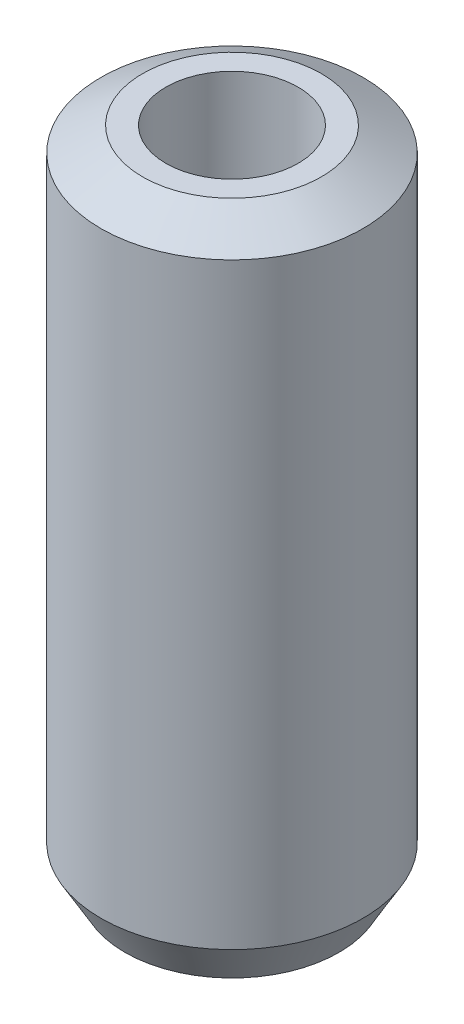
from build123d import *
from OCP.BRepFilletAPI import BRepFilletAPI_MakeChamfer

# Parameters (mm, degrees)
SKETCH1_R           = 30
BOSS_EXTRUDE1_DEPTH = 151.770530502
SKETCH2_R           = 15.139568422
CUT_EXTRUDE1_DEPTH  = 158.589003197
CHAMFER1_SIZE       = 5.49618952
CHAMFER1_SIZE2      = 9.519679497


with BuildPart() as part:
    # Sketch1 → Boss-Extrude1 (new body)
    with BuildSketch(Plane(origin=(0, 0, 0), x_dir=(1, 0, 0), z_dir=(0, 1, 0))):
        Circle(SKETCH1_R)
    extrude(amount=BOSS_EXTRUDE1_DEPTH)

    # Sketch2 → Cut-Extrude1 (cut, through all)
    with BuildSketch(Plane(origin=(0, 0, 0), x_dir=(1, 0, 0), z_dir=(0, 1, 0))):
        Circle(SKETCH2_R)
    extrude(amount=CUT_EXTRUDE1_DEPTH, mode=Mode.SUBTRACT)

    # Chamfer1: one chamfer whose edges measure the first distance from different faces: ONE call of the kernel's chamfer builder (chamfer() names one face for all edges)
    chamfer1_edges_1 = [part.edges().sort_by_distance(p)[0] for p in [
        (-30, 151.770530502, 0),
    ]]
    chamfer1_side_1 = [part.faces().sort_by_distance(p)[0] for p in [
        (-30, 75.885265251, 0),
    ]]
    chamfer1_edges_2 = [part.edges().sort_by_distance(p)[0] for p in [
        (-30, 0, 0),
    ]]
    chamfer1_side_2 = [part.faces().sort_by_distance(p)[0] for p in [
        (-29.151471863, 0, 0),
    ]]
    chamfer1 = BRepFilletAPI_MakeChamfer(part.part.solid().wrapped)
    for e in chamfer1_edges_1:
        chamfer1.Add(CHAMFER1_SIZE, CHAMFER1_SIZE2, e.wrapped, chamfer1_side_1[0].wrapped)  # the first distance lies on this face
    for e in chamfer1_edges_2:
        chamfer1.Add(CHAMFER1_SIZE, CHAMFER1_SIZE2, e.wrapped, chamfer1_side_2[0].wrapped)  # the first distance lies on this face
    add(Compound.cast(chamfer1.Shape()), mode=Mode.REPLACE)


solid = part.part
